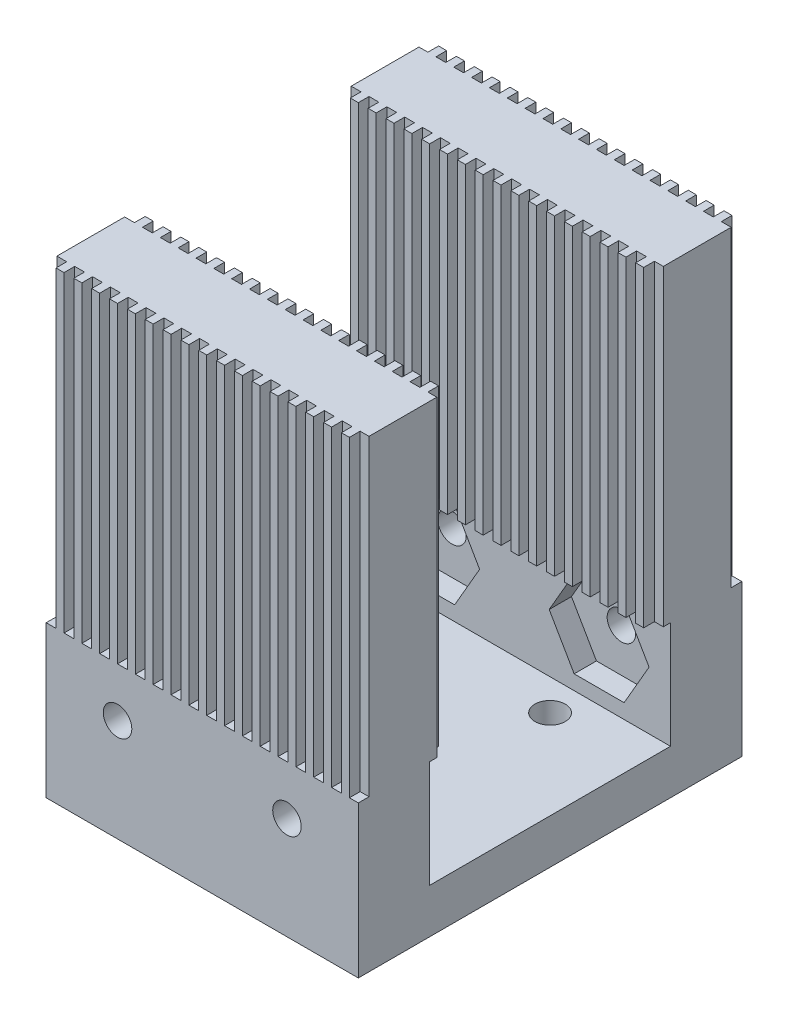
from build123d import *

# Parameters (mm, degrees)
SKETCH11_W          = 35
SKETCH11_H          = 27
BOSS_EXTRUDE6_DEPTH = 5
SKETCH12_R          = 1.7
CUT_EXTRUDE3_DEPTH  = 5
SKETCH13_W          = 35
SKETCH13_H          = 8
BOSS_EXTRUDE7_DEPTH = 17
SKETCH14_W          = 35
SKETCH14_H          = 10
BOSS_EXTRUDE8_DEPTH = 35
SKETCH15_W          = 1.1
SKETCH15_H          = 35
CUT_EXTRUDE4_DEPTH  = 1.2
SKETCH16_W          = 1.1
SKETCH16_H          = 35
CUT_EXTRUDE5_DEPTH  = 1.2
SKETCH17_W          = 1.1
SKETCH17_H          = 35
CUT_EXTRUDE6_DEPTH  = 1.2
SKETCH18_W          = 1.1
SKETCH18_H          = 35
CUT_EXTRUDE7_DEPTH  = 1.2
SKETCH19_R          = 1.6
CUT_EXTRUDE8_DEPTH  = 73.684248638
CUT_EXTRUDE9_DEPTH  = 2.5
CUT_EXTRUDE10_DEPTH = 2.5


with BuildPart() as part:
    # Sketch11 → Boss-Extrude6 (new body)
    with BuildSketch(Plane(origin=(0, 0, 12.5), x_dir=(1, 0, 0), z_dir=(0, -1, 0))):
        with Locations((17.5, -13.5)):
            Rectangle(SKETCH11_W, SKETCH11_H)
    extrude(amount=BOSS_EXTRUDE6_DEPTH)

    # Sketch12 → Cut-Extrude3 (cut)
    with BuildSketch(Plane.XZ.offset(5)):
        with Locations((10, 9)):
            Circle(SKETCH12_R)
        with Locations((25, 9)):
            Circle(SKETCH12_R)
        with Locations((25, -11)):
            Circle(SKETCH12_R)
        with Locations((10, -11)):
            Circle(SKETCH12_R)
    extrude(amount=-CUT_EXTRUDE3_DEPTH, mode=Mode.SUBTRACT)

    # Sketch13 → Boss-Extrude7 (add)
    with BuildSketch(Plane.XZ.offset(5)):
        with Locations((17.5, -18.5)):
            Rectangle(SKETCH13_W, SKETCH13_H)
        with Locations((17.5, 16.5)):
            Rectangle(SKETCH13_W, SKETCH13_H)
    extrude(amount=-BOSS_EXTRUDE7_DEPTH)

    # Sketch14 → Boss-Extrude8 (add)
    with BuildSketch(Plane(origin=(0, 12, 0), x_dir=(1, 0, 0), z_dir=(0, 1, 0))):
        with Locations((17.5, -15.5)):
            Rectangle(SKETCH14_W, SKETCH14_H)
        with Locations((17.5, 17.5)):
            Rectangle(SKETCH14_W, SKETCH14_H)
    extrude(amount=BOSS_EXTRUDE8_DEPTH)

    # Sketch15 → Cut-Extrude4 (cut)
    with BuildSketch(Plane(origin=(0, 0, 10.5), x_dir=(-1, 0, 0), z_dir=(0, 0, -1))):
        with Locations((-0.55, 29.5)):
            Rectangle(SKETCH15_W, SKETCH15_H)
        with Locations((-2.55, 29.5)):
            Rectangle(SKETCH15_W, SKETCH15_H)
        with Locations((-4.55, 29.5)):
            Rectangle(SKETCH15_W, SKETCH15_H)
        with Locations((-6.55, 29.5)):
            Rectangle(SKETCH15_W, SKETCH15_H)
        with Locations((-8.55, 29.5)):
            Rectangle(SKETCH15_W, SKETCH15_H)
        with Locations((-10.55, 29.5)):
            Rectangle(SKETCH15_W, SKETCH15_H)
        with Locations((-12.55, 29.5)):
            Rectangle(SKETCH15_W, SKETCH15_H)
        with Locations((-14.55, 29.5)):
            Rectangle(SKETCH15_W, SKETCH15_H)
        with Locations((-16.55, 29.5)):
            Rectangle(SKETCH15_W, SKETCH15_H)
        with Locations((-18.55, 29.5)):
            Rectangle(SKETCH15_W, SKETCH15_H)
        with Locations((-20.55, 29.5)):
            Rectangle(SKETCH15_W, SKETCH15_H)
        with Locations((-22.55, 29.5)):
            Rectangle(SKETCH15_W, SKETCH15_H)
        with Locations((-24.55, 29.5)):
            Rectangle(SKETCH15_W, SKETCH15_H)
        with Locations((-26.55, 29.5)):
            Rectangle(SKETCH15_W, SKETCH15_H)
        with Locations((-28.55, 29.5)):
            Rectangle(SKETCH15_W, SKETCH15_H)
        with Locations((-30.55, 29.5)):
            Rectangle(SKETCH15_W, SKETCH15_H)
        with Locations((-32.55, 29.5)):
            Rectangle(SKETCH15_W, SKETCH15_H)
        with Locations((-34.55, 29.5)):
            Rectangle(SKETCH15_W, SKETCH15_H)
    extrude(amount=-CUT_EXTRUDE4_DEPTH, mode=Mode.SUBTRACT)

    # Sketch16 → Cut-Extrude5 (cut)
    with BuildSketch(Plane.XY.offset(-12.5)):
        with Locations((0.55, 29.5)):
            Rectangle(SKETCH16_W, SKETCH16_H)
        with Locations((2.55, 29.5)):
            Rectangle(SKETCH16_W, SKETCH16_H)
        with Locations((4.55, 29.5)):
            Rectangle(SKETCH16_W, SKETCH16_H)
        with Locations((6.55, 29.5)):
            Rectangle(SKETCH16_W, SKETCH16_H)
        with Locations((8.55, 29.5)):
            Rectangle(SKETCH16_W, SKETCH16_H)
        with Locations((10.55, 29.5)):
            Rectangle(SKETCH16_W, SKETCH16_H)
        with Locations((12.55, 29.5)):
            Rectangle(SKETCH16_W, SKETCH16_H)
        with Locations((14.55, 29.5)):
            Rectangle(SKETCH16_W, SKETCH16_H)
        with Locations((16.55, 29.5)):
            Rectangle(SKETCH16_W, SKETCH16_H)
        with Locations((18.55, 29.5)):
            Rectangle(SKETCH16_W, SKETCH16_H)
        with Locations((20.55, 29.5)):
            Rectangle(SKETCH16_W, SKETCH16_H)
        with Locations((22.55, 29.5)):
            Rectangle(SKETCH16_W, SKETCH16_H)
        with Locations((24.55, 29.5)):
            Rectangle(SKETCH16_W, SKETCH16_H)
        with Locations((26.55, 29.5)):
            Rectangle(SKETCH16_W, SKETCH16_H)
        with Locations((28.55, 29.5)):
            Rectangle(SKETCH16_W, SKETCH16_H)
        with Locations((30.55, 29.5)):
            Rectangle(SKETCH16_W, SKETCH16_H)
        with Locations((32.55, 29.5)):
            Rectangle(SKETCH16_W, SKETCH16_H)
        with Locations((34.55, 29.5)):
            Rectangle(SKETCH16_W, SKETCH16_H)
    extrude(amount=-CUT_EXTRUDE5_DEPTH, mode=Mode.SUBTRACT)

    # Sketch17 → Cut-Extrude6 (cut)
    with BuildSketch(Plane.XY.offset(20.5)):
        with Locations((2.55, 29.5)):
            Rectangle(SKETCH17_W, SKETCH17_H)
        with Locations((0.55, 29.5)):
            Rectangle(SKETCH17_W, SKETCH17_H)
        with Locations((4.55, 29.5)):
            Rectangle(SKETCH17_W, SKETCH17_H)
        with Locations((6.55, 29.5)):
            Rectangle(SKETCH17_W, SKETCH17_H)
        with Locations((8.55, 29.5)):
            Rectangle(SKETCH17_W, SKETCH17_H)
        with Locations((10.55, 29.5)):
            Rectangle(SKETCH17_W, SKETCH17_H)
        with Locations((12.55, 29.5)):
            Rectangle(SKETCH17_W, SKETCH17_H)
        with Locations((14.55, 29.5)):
            Rectangle(SKETCH17_W, SKETCH17_H)
        with Locations((16.55, 29.5)):
            Rectangle(SKETCH17_W, SKETCH17_H)
        with Locations((18.55, 29.5)):
            Rectangle(SKETCH17_W, SKETCH17_H)
        with Locations((20.55, 29.5)):
            Rectangle(SKETCH17_W, SKETCH17_H)
        with Locations((22.55, 29.5)):
            Rectangle(SKETCH17_W, SKETCH17_H)
        with Locations((24.55, 29.5)):
            Rectangle(SKETCH17_W, SKETCH17_H)
        with Locations((26.55, 29.5)):
            Rectangle(SKETCH17_W, SKETCH17_H)
        with Locations((28.55, 29.5)):
            Rectangle(SKETCH17_W, SKETCH17_H)
        with Locations((30.55, 29.5)):
            Rectangle(SKETCH17_W, SKETCH17_H)
        with Locations((32.55, 29.5)):
            Rectangle(SKETCH17_W, SKETCH17_H)
        with Locations((34.55, 29.5)):
            Rectangle(SKETCH17_W, SKETCH17_H)
    extrude(amount=-CUT_EXTRUDE6_DEPTH, mode=Mode.SUBTRACT)

    # Sketch18 → Cut-Extrude7 (cut)
    with BuildSketch(Plane(origin=(0, 0, -22.5), x_dir=(-1, 0, 0), z_dir=(0, 0, -1))):
        with Locations((-32.45, 29.5)):
            Rectangle(SKETCH18_W, SKETCH18_H)
        with Locations((-34.45, 29.5)):
            Rectangle(SKETCH18_W, SKETCH18_H)
        with Locations((-30.45, 29.5)):
            Rectangle(SKETCH18_W, SKETCH18_H)
        with Locations((-28.45, 29.5)):
            Rectangle(SKETCH18_W, SKETCH18_H)
        with Locations((-26.45, 29.5)):
            Rectangle(SKETCH18_W, SKETCH18_H)
        with Locations((-24.45, 29.5)):
            Rectangle(SKETCH18_W, SKETCH18_H)
        with Locations((-22.45, 29.5)):
            Rectangle(SKETCH18_W, SKETCH18_H)
        with Locations((-20.45, 29.5)):
            Rectangle(SKETCH18_W, SKETCH18_H)
        with Locations((-18.45, 29.5)):
            Rectangle(SKETCH18_W, SKETCH18_H)
        with Locations((-16.45, 29.5)):
            Rectangle(SKETCH18_W, SKETCH18_H)
        with Locations((-14.45, 29.5)):
            Rectangle(SKETCH18_W, SKETCH18_H)
        with Locations((-12.45, 29.5)):
            Rectangle(SKETCH18_W, SKETCH18_H)
        with Locations((-10.45, 29.5)):
            Rectangle(SKETCH18_W, SKETCH18_H)
        with Locations((-8.45, 29.5)):
            Rectangle(SKETCH18_W, SKETCH18_H)
        with Locations((-6.45, 29.5)):
            Rectangle(SKETCH18_W, SKETCH18_H)
        with Locations((-4.45, 29.5)):
            Rectangle(SKETCH18_W, SKETCH18_H)
        with Locations((-2.45, 29.5)):
            Rectangle(SKETCH18_W, SKETCH18_H)
        with Locations((-0.45, 29.5)):
            Rectangle(SKETCH18_W, SKETCH18_H)
    extrude(amount=-CUT_EXTRUDE7_DEPTH, mode=Mode.SUBTRACT)

    # Sketch19 → Cut-Extrude8 (cut, through all)
    with BuildSketch(Plane(origin=(0, 0, -22.5), x_dir=(-1, 0, 0), z_dir=(0, 0, -1))):
        with Locations((-27, 6.485099569)):
            Circle(SKETCH19_R)
        with Locations((-8, 6.485099569)):
            Circle(SKETCH19_R)
    extrude(amount=-CUT_EXTRUDE8_DEPTH, mode=Mode.SUBTRACT)

    # Sketch20 → Cut-Extrude9 (cut)
    with BuildSketch(Plane.XY.offset(-14.5)):
        Polygon((29.8, 1.635357307), (32.6, 6.485099569), (29.8, 11.33484183), (24.2, 11.33484183), (21.4, 6.485099569), (24.2, 1.635357307), align=None)
        Polygon((10.8, 1.635357307), (13.6, 6.485099569), (10.8, 11.33484183), (5.2, 11.33484183), (2.4, 6.485099569), (5.2, 1.635357307), align=None)
    extrude(amount=-CUT_EXTRUDE9_DEPTH, mode=Mode.SUBTRACT)

    # Sketch21 → Cut-Extrude10 (cut)
    with BuildSketch(Plane(origin=(0, 0, 12.5), x_dir=(-1, 0, 0), z_dir=(0, 0, -1))):
        Polygon((-5.2, 1.635357307), (-2.4, 6.485099569), (-5.2, 11.33484183), (-10.8, 11.33484183), (-13.6, 6.485099569), (-10.8, 1.635357307), align=None)
        Polygon((-24.2, 1.635357307), (-21.4, 6.485099569), (-24.2, 11.33484183), (-29.8, 11.33484183), (-32.6, 6.485099569), (-29.8, 1.635357307), align=None)
    extrude(amount=-CUT_EXTRUDE10_DEPTH, mode=Mode.SUBTRACT)


solid = part.part
